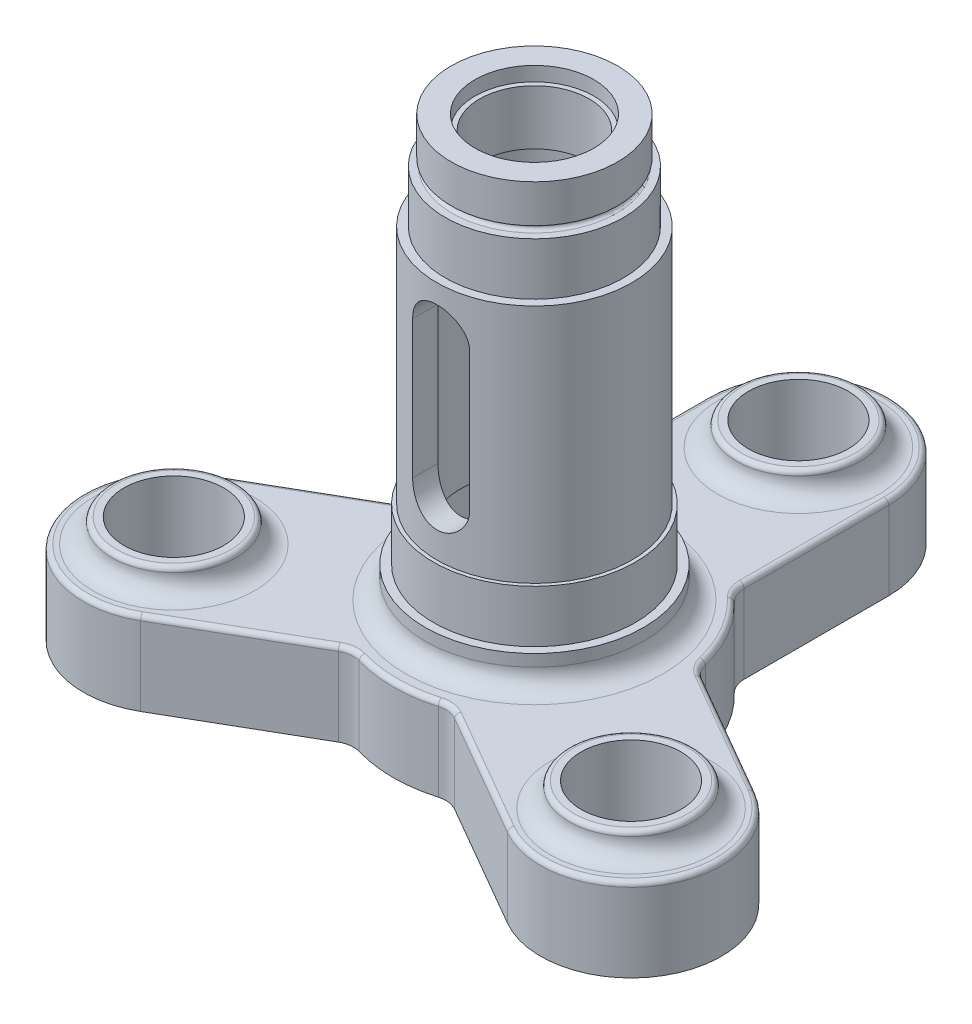
from build123d import *

# Parameters (mm, degrees)
SCHIZZO1_R                     = 26
SCHIZZO1_R_2                   = 21
ESTRUSIONE_ESTRUSIONE3_DEPTH   = 45
ESTRUSIONE_ESTRUSIONE3_2_DEPTH = 45
ESTRUSIONE_ESTRUSIONE3_3_DEPTH = 45
SCHIZZO1_5_R                   = 26
ESTRUSIONE_ESTRUSIONE4_DEPTH   = 35
RACCORDO2_R                    = 10
TAGLIO_ESTRUSIONE1_DEPTH       = 315.697537814
RACCORDO3_R                    = 8
RACCORDO4_R                    = 2
RACCORDO5_R                    = 1.5


with BuildPart() as part:
    # Schizzo1 → Estrusione-Estrusione3 (new body)
    with BuildSketch(Plane(origin=(0, 0, 0), x_dir=(1, 0, 0), z_dir=(0, 1, 0))):
        with Locations(Location((-96.12881982, -55.5, 0), (0, 0, 90))):
            Circle(SCHIZZO1_R)
        with Locations(Location((-96.12881982, -55.5, 0), (0, 0, 90))):
            Circle(SCHIZZO1_R_2, mode=Mode.SUBTRACT)
    extrude(amount=ESTRUSIONE_ESTRUSIONE3_DEPTH)



with BuildPart() as body_2:
    # Schizzo1 → Estrusione-Estrusione3 2 (new body)
    with BuildSketch(Plane(origin=(0, 0, 0), x_dir=(1, 0, 0), z_dir=(0, 1, 0))):
        with Locations(Location((96.12881982, -55.5, 0), (0, 0, 90))):
            Circle(SCHIZZO1_R)
        with Locations(Location((96.12881982, -55.5, 0), (0, 0, 90))):
            Circle(SCHIZZO1_R_2, mode=Mode.SUBTRACT)
    extrude(amount=ESTRUSIONE_ESTRUSIONE3_2_DEPTH)


with BuildPart() as body_3:
    # Schizzo1 → Estrusione-Estrusione3 3 (new body)
    with BuildSketch(Plane(origin=(0, 0, 0), x_dir=(1, 0, 0), z_dir=(0, 1, 0))):
        with Locations(Location((0, 111, 0), (0, 0, 90))):
            Circle(SCHIZZO1_R)
        with Locations(Location((0, 111, 0), (0, 0, 90))):
            Circle(SCHIZZO1_R_2, mode=Mode.SUBTRACT)
    extrude(amount=ESTRUSIONE_ESTRUSIONE3_3_DEPTH)


with BuildPart() as part_1:
    add(part.part)

    add(body_2.part)  # Estrusione-Estrusione4 merges body 2

    add(body_3.part)  # Estrusione-Estrusione4 merges body 3
    # Schizzo1<5> → Estrusione-Estrusione4 (add)
    with BuildSketch(Plane(origin=(0, 0, 0), x_dir=(1, 0, 0), z_dir=(0, 1, 0))):
        with BuildLine():
            Line((115.12881982, -22.591034656), (58.562917379, 10.067304345))
            ThreePointArc((58.562917379, 10.067304345), (51.46090197, 29.710965605), (38, 45.683321997))
            Line((38, 45.683321997), (38, 111))
            ThreePointArc((38, 111), (0, 149), (-38, 111))
            Line((-38, 111), (-38, 45.683321997))
            ThreePointArc((-38, 45.683321997), (-51.46090197, 29.710965605), (-58.562917379, 10.067304345))
            Line((-58.562917379, 10.067304345), (-115.12881982, -22.591034656))
            ThreePointArc((-115.12881982, -22.591034656), (-129.037785164, -74.5), (-77.12881982, -88.408965344))
            Line((-77.12881982, -88.408965344), (-20.562917379, -55.750626342))
            ThreePointArc((-20.562917379, -55.750626342), (0, -59.42193121), (20.562917379, -55.750626342))
            Line((20.562917379, -55.750626342), (77.12881982, -88.408965344))
            ThreePointArc((77.12881982, -88.408965344), (129.037785164, -74.5), (115.12881982, -22.591034656))
        make_face()
        with Locations(Location((0, 111, 0), (0, 0, 90))):
            Circle(SCHIZZO1_5_R, mode=Mode.SUBTRACT)
        with Locations(Location((96.12881982, -55.5, 0), (0, 0, 90))):
            Circle(SCHIZZO1_5_R, mode=Mode.SUBTRACT)
        with Locations(Location((-96.12881982, -55.5, 0), (0, 0, 90))):
            Circle(SCHIZZO1_5_R, mode=Mode.SUBTRACT)
    extrude(amount=ESTRUSIONE_ESTRUSIONE4_DEPTH)

    # Raccordo2
    raccordo2_edges = [part_1.edges().sort_by_distance(p)[0] for p in [
        (58.562917379, 17.5, -10.067304345),
        (38, 17.5, -45.683321997),
        (-38, 17.5, -45.683321997),
        (-58.562917379, 17.5, -10.067304345),
        (-20.562917379, 17.5, 55.750626342),
        (20.562917379, 17.5, 55.750626342),
    ]]
    fillet(raccordo2_edges, radius=RACCORDO2_R)

    # Schizzo3 → Rivoluzione-Sottile1 (revolve)
    with BuildSketch(Plane(origin=(0, 0, 0), x_dir=(0, 0, -1), z_dir=(1, 0, 0))):
        Polygon((35, 212), (35, 196), (33, 196), (33, 193), (37.5, 193), (37.5, 171), (41, 171), (41, 70), (42.5, 70), (42.5, 48), (46, 48), (46, 35), (36, 35), (36, 38), (32.5, 38), (32.5, 60), (31, 60), (31, 161), (27.5, 161), (27.5, 183), (23, 183), (23, 206), (25, 206), (25, 212), align=None)
    revolve(axis=Axis((0, 0, 0), (0, 1, 0)))

    # Schizzo4 → Taglio-Estrusione1 (cut, through all)
    with BuildSketch(Plane.XY.offset(41)):
        with BuildLine():
            Line((12, 151), (12, 93))
            ThreePointArc((12, 93), (0, 81), (-12, 93))
            Line((-12, 93), (-12, 151))
            ThreePointArc((-12, 151), (0, 163), (12, 151))
        make_face()
    extrude(amount=-TAGLIO_ESTRUSIONE1_DEPTH, mode=Mode.SUBTRACT)

    # Raccordo3
    raccordo3_edges = [part_1.edges().sort_by_distance(p)[0] for p in [
        (0, 35, 46),
        (-96.12881982, 35, 81.5),
        (96.12881982, 35, 81.5),
        (0, 35, -85),
    ]]
    fillet(raccordo3_edges, radius=RACCORDO3_R)

    # Raccordo4
    raccordo4_edges = [part_1.edges().sort_by_distance(p)[0] for p in [
        (38, 35, -80.576904379),
        (-96.12881982, 45, 81.5),
        (-88.78164615, 35, 7.379486846),
        (50.78164615, 35, 73.197417533),
        (88.78164615, 35, 7.379486846),
        (0, 35, -149),
        (-38, 35, -80.576904379),
        (-129.037785164, 35, 74.5),
        (-50.78164615, 35, 73.197417533),
        (129.037785164, 35, 74.5),
        (96.12881982, 45, 81.5),
        (0, 45, -85),
        (-51.46090197, 35, -29.710965605),
        (51.46090197, 35, -29.710965605),
        (0, 35, 59.42193121),
        (-59.434637608, 35, -10.49209484),
        (-38.803739474, 35, -46.225858613),
        (38.803739474, 35, -46.225858613),
        (59.434637608, 35, -10.49209484),
        (20.630898134, 35, 56.717953453),
        (-20.630898134, 35, 56.717953453),
    ]]
    fillet(raccordo4_edges, radius=RACCORDO4_R - 0.0001)  # a hair under: the kernel refuses the full size

    # Raccordo5
    raccordo5_edges = [part_1.edges().sort_by_distance(p)[0] for p in [
        (0, 193, 33),
        (0, 196, 33),
    ]]
    fillet(raccordo5_edges, radius=RACCORDO5_R - 0.0001)  # a hair under: the kernel refuses the full size


solid = part_1.part
